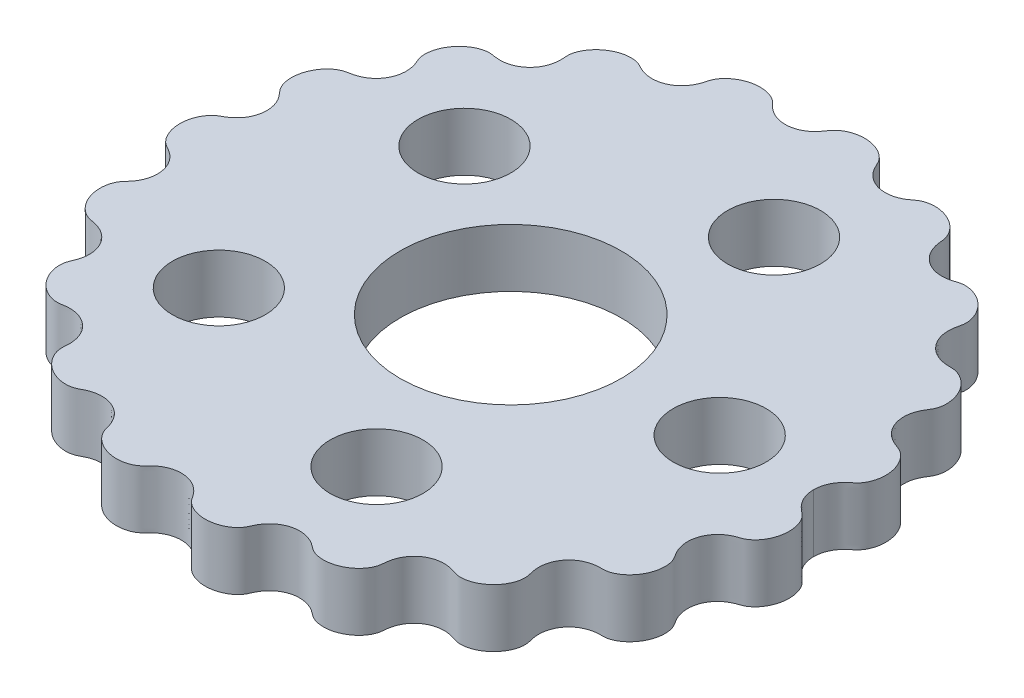
from build123d import *

# Parameters (mm, degrees)
BOSS_EXTRUDE1_START = 0.5
SKETCH1_R           = 9.525
SKETCH1_R_2         = 4
BOSS_EXTRUDE1_DEPTH = 5


with BuildPart() as part:
    # Sketch1 → Boss-Extrude1 (new body)
    with BuildSketch(Plane(origin=(0, 0, 0), x_dir=(1, 0, 0), z_dir=(0, 1, 0)).offset(BOSS_EXTRUDE1_START)):
        with BuildLine():
            add(Edge.make_bspline(
                [(26.1, 0), (26.1, -0.037654823), (26.101959838, -0.112657778), (26.110778913, -0.269126865), (26.134236473, -0.431457933), (26.169271902, -0.604227737), (26.215706934, -0.771665888), (26.273295099, -0.936077152), (26.341753554, -1.096140667), (26.427915849, -1.265624131), (26.534785054, -1.441856171), (26.699683698, -1.67031679), (26.901439536, -1.88987584), (27.124804261, -2.086960491), (27.362808407, -2.265185488), (27.541686595, -2.422902757), (27.696832366, -2.612532966), (27.831038283, -2.823925745), (27.942707414, -3.055157968), (28.032027129, -3.302051278), (28.11328707, -3.620150325), (28.164200716, -4.011385863), (28.158229712, -4.465911271), (28.068723695, -4.971978987), (27.922396839, -5.391891507), (27.752179238, -5.726439419), (27.579155333, -5.986088777), (27.422588116, -6.181127718), (27.208663224, -6.396612626), (26.970426874, -6.581500429), (26.704262293, -6.714420074), (26.426139511, -6.802056051), (26.208386955, -6.88526241), (25.996005013, -6.981754411), (25.792352168, -7.095680473), (25.506454673, -7.288419365), (25.166810015, -7.595932092), (24.823327666, -8.065640834), (24.573113299, -8.722842261), (24.513192386, -9.374110704), (24.595878356, -9.908866565), (24.732910005, -10.306165942), (24.863450157, -10.578322253), (24.983619743, -10.787813544), (25.118076955, -10.987994036), (25.243899654, -11.194436481), (25.335973848, -11.425133948), (25.399465388, -11.670686177), (25.434320142, -11.928228009), (25.441972482, -12.193681648), (25.418791023, -12.524941115), (25.342360012, -12.916594688), (25.19123207, -13.347764304), (24.944934541, -13.798710217), (24.636097611, -14.197365909), (24.319379046, -14.492995791), (24.014552178, -14.704170688), (23.744181637, -14.84409763), (23.521984723, -14.930759504), (23.295178333, -14.99089675), (23.066212192, -15.018050457), (22.836177533, -15.015427607), (22.606453619, -15.01876633), (22.377139997, -15.037432831), (22.149964765, -15.073477643), (21.901722715, -15.134262004), (21.636405279, -15.227464361), (21.285248204, -15.397408544), (20.867012031, -15.696199645), (20.457707613, -16.15442787), (20.167634198, -16.744097483), (20.040652676, -17.344074218), (20.044251146, -17.837567352), (20.101291606, -18.208300972), (20.178290252, -18.510160997), (20.237387065, -18.752911084), (20.25416585, -19.007094176), (20.236737196, -19.264546648), (20.175345508, -19.587685891), (20.045401481, -19.966212229), (19.825733648, -20.379092954), (19.503349147, -20.792215121), (19.125691797, -21.140607349), (18.706122195, -21.419205006), (18.312603134, -21.597813456), (17.957291469, -21.7007495), (17.659059082, -21.747208145), (17.425046357, -21.759337106), (17.196962801, -21.74598206), (16.978070968, -21.704489959), (16.76754266, -21.633081261), (16.557577444, -21.561231407), (16.343192491, -21.502693833), (16.125264662, -21.459296016), (15.796467784, -21.420434357), (15.354937395, -21.427964236), (14.788969175, -21.550301969), (14.154555419, -21.88057341), (13.666183716, -22.345893253), (13.336362648, -22.88226304), (13.173492135, -23.353715628), (13.104616127, -23.716957195), (13.076673275, -24.02279806), (13.057814188, -24.268242303), (12.998712205, -24.514111874), (12.903235055, -24.754151925), (12.744151813, -25.045309117), (12.499019901, -25.369043134), (12.15565715, -25.696338346), (11.704870212, -25.994619846), (11.211604107, -26.212225806), (10.689976759, -26.343697667), (10.221282681, -26.37756552), (9.820613034, -26.342575187), (9.498973157, -26.26665957), (9.255580912, -26.177092448), (9.029799658, -26.056558541), (8.831572761, -25.902571784), (8.58391576, -25.71111477), (8.26446612, -25.51104552), (7.810081455, -25.312340621), (7.205513818, -25.192791232), (6.550224923, -25.228730886), (5.971337017, -25.424349477), (5.536862388, -25.687803773), (5.245653306, -25.938729612), (5.05538626, -26.143844122), (4.899938261, -26.348212338), (4.774598737, -26.545523005), (4.66455004, -26.751857795), (4.569043475, -26.964881996), (4.476314366, -27.179586841), (4.35349979, -27.379281189), (4.203299855, -27.561863118), (4.032131291, -27.727950003), (3.795258989, -27.914521158), (3.482483913, -28.102825699), (3.089596664, -28.268830385), (2.604961188, -28.388334129), (2.095437225, -28.431200093), (1.573536082, -28.390048007), (1.119470452, -28.272805038), (0.751616161, -28.112409401), (0.472786699, -27.939857046), (0.273494126, -27.780889901), (0.100220003, -27.601224467), (-0.036900458, -27.400701128), (-0.167623209, -27.196704665), (-0.313051845, -27.002366981), (-0.512485216, -26.773835259), (-0.825221581, -26.489940267), (-1.286824514, -26.202366803), (-1.906524561, -26.003420899), (-2.599411553, -25.975353149), (-3.156761697, -26.100953574), (-3.565273796, -26.283242121), (-3.85343043, -26.463789354), (-4.040862241, -26.604608953), (-4.216144571, -26.760241463), (-4.380398315, -26.92724911), (-4.535647832, -27.102695562), (-4.708038901, -27.262129389), (-4.906562373, -27.395532872), (-5.122340192, -27.506639083), (-5.353111082, -27.594765527), (-5.595122062, -27.660809079), (-5.904112165, -27.714960076), (-6.280362612, -27.736643211), (-6.724192808, -27.701413516), (-7.222479814, -27.579956195), (-7.639241179, -27.403463388), (-7.974539319, -27.20159547), (-8.231562236, -27.001455404), (-8.420763279, -26.822438839), (-8.588375147, -26.628010193), (-8.729951421, -26.419225268), (-8.843841456, -26.197883212), (-8.918149442, -25.965106023), (-8.973095058, -25.727696563), (-9.043925473, -25.494305037), (-9.153099618, -25.209622768), (-9.306801806, -24.915867583), (-9.513499076, -24.623747572), (-9.839816185, -24.284860522), (-10.264400599, -23.977825959), (-10.829665695, -23.73805203), (-11.410498796, -23.660908882), (-11.876291721, -23.69638221), (-12.218754959, -23.773476834), (-12.444677349, -23.845131331), (-12.663781479, -23.935334112), (-12.876076729, -24.040286172), (-13.082031425, -24.157155246), (-13.298581127, -24.254322867), (-13.533913594, -24.317810826), (-13.780466915, -24.35378875), (-14.035834908, -24.361637388), (-14.29640587, -24.343065665), (-14.618522573, -24.288656576), (-14.994949776, -24.177456101), (-15.40857897, -23.98833338), (-15.837205258, -23.700628449), (-16.164907311, -23.393911293), (-16.404344734, -23.097848292), (-16.573318676, -22.829755719), (-16.687662049, -22.603571121), (-16.776686853, -22.372337621), (-16.837746076, -22.138542446), (-16.870186159, -21.9045043), (-16.866368416, -21.674536104), (-16.843233106, -21.446228653), (-16.832615307, -21.216921003), (-16.837266827, -20.987328792), (-16.860312683, -20.758768834), (-16.923293404, -20.419212422), (-17.071833991, -19.980587652), (-17.369040524, -19.477210915), (-17.874882375, -18.988476541), (-18.447970133, -18.67719025), (-19.027548134, -18.525710765), (-19.510111737, -18.503831617), (-19.87664814, -18.538267665), (-20.177623885, -18.593432706), (-20.421371941, -18.622411671), (-20.671244853, -18.609095567), (-20.920859775, -18.564988583), (-21.167935078, -18.490627654), (-21.4095885, -18.389962143), (-21.698210119, -18.235368531), (-22.02014446, -18.009296139), (-22.350982927, -17.698329853), (-22.663749807, -17.29065213), (-22.904833826, -16.843369276), (-23.047778377, -16.427343965), (-23.116267899, -16.057121475), (-23.13204139, -15.75076918), (-23.118687314, -15.513701439), (-23.079662446, -15.285779121), (-23.010740762, -15.071995011), (-22.917965639, -14.867945737), (-22.831783511, -14.661241535), (-22.759010838, -14.449176582), (-22.702274861, -14.232285466), (-22.657962992, -13.982307736), (-22.635886805, -13.699380389), (-22.650675118, -13.300053937), (-22.761871082, -12.783822482), (-23.029318637, -12.21492364), (-23.467562019, -11.712001704), (-23.923403018, -11.398122255), (-24.315464064, -11.222988994), (-24.609412242, -11.131419108), (-24.849484665, -11.076013531), (-25.092573069, -11.038656205), (-25.334505588, -10.990769991), (-25.569274269, -10.900544213), (-25.793687584, -10.779741828), (-26.005954771, -10.630692764), (-26.204437626, -10.457777096), (-26.43033221, -10.218351564), (-26.664824109, -9.899800806), (-26.878975385, -9.499593675), (-27.044436206, -9.01574461), (-27.129961924, -8.520121003), (-27.134474175, -8.0871314), (-27.084857153, -7.719810764), (-27.006013082, -7.425910719), (-26.920443462, -7.203342298), (-26.812236107, -6.99521479), (-26.678616217, -6.807274427), (-26.521312285, -6.639361313), (-26.367637466, -6.468593342), (-26.225484226, -6.287683037), (-26.097389187, -6.096643611), (-25.974680445, -5.876177314), (-25.864713463, -5.624531597), (-25.752433682, -5.264729725), (-25.681810262, -4.762581394), (-25.73099742, -4.146949182), (-25.961949286, -3.524047609), (-26.321265325, -3.010597952), (-26.690239718, -2.672986455), (-27.000992368, -2.462677557), (-27.274877294, -2.314024503), (-27.49416336, -2.194208061), (-27.693761753, -2.035785351), (-27.872384261, -1.849426066), (-28.029881682, -1.639477669), (-28.165833209, -1.41056993), (-28.278417606, -1.169112764), (-28.356850629, -0.949924532), (-28.40992651, -0.757383066), (-28.444786226, -0.594531067), (-28.467072671, -0.464613598), (-28.483773852, -0.334062838), (-28.494901549, -0.194206271), (-28.499073008, -0.086237954), (-28.5, -0.028769446), (-28.5, 0)],
                knots=[0.065357727, 0.065357727, 0.065357727, 0.065357727, 0.065357727, 0.066838802, 0.068319877, 0.069800952, 0.071282027, 0.072763102, 0.074244177, 0.075725252, 0.077206327, 0.079230954, 0.081255581, 0.085304836, 0.087329463, 0.08935409, 0.091378717, 0.093403344, 0.095635344, 0.097867345, 0.100099346, 0.102331347, 0.106795348, 0.11125935, 0.115505731, 0.119752112, 0.121875303, 0.123998494, 0.126121685, 0.128244875, 0.132212277, 0.134195978, 0.136179679, 0.13816338, 0.140147081, 0.142130782, 0.144114483, 0.149889299, 0.155664115, 0.161716618, 0.167769121, 0.171875721, 0.17392902, 0.17598232, 0.17803562, 0.18008892, 0.182142219, 0.184195519, 0.186452911, 0.188710303, 0.190967695, 0.193225087, 0.197739871, 0.202254655, 0.206449673, 0.210644692, 0.21483971, 0.216937219, 0.219034728, 0.220990732, 0.222946736, 0.22490274, 0.226858744, 0.228814748, 0.230770752, 0.232726756, 0.23468276, 0.237505487, 0.240328214, 0.245973668, 0.25207373, 0.258173791, 0.262418319, 0.266662848, 0.268785112, 0.270907376, 0.27302964, 0.275151904, 0.277414155, 0.279676405, 0.284200907, 0.288725408, 0.29324991, 0.297434601, 0.301619291, 0.305803982, 0.307896327, 0.309988673, 0.311878349, 0.313768025, 0.315657701, 0.317547377, 0.319437053, 0.32132673, 0.323216406, 0.325106082, 0.330697764, 0.336289446, 0.3427217, 0.349153953, 0.353337838, 0.357521724, 0.359613666, 0.361705609, 0.363797552, 0.365889495, 0.368183967, 0.37047844, 0.375067386, 0.379656332, 0.384245278, 0.388791482, 0.393337686, 0.39788389, 0.400156991, 0.402430093, 0.404562559, 0.406695025, 0.408827491, 0.410959957, 0.415224889, 0.419489821, 0.425619329, 0.431748836, 0.43728204, 0.440048642, 0.442815244, 0.444803142, 0.446791041, 0.44877894, 0.450766838, 0.452754737, 0.454742636, 0.456730534, 0.458718433, 0.460783687, 0.462848941, 0.466979449, 0.471109956, 0.475240464, 0.479777245, 0.484314026, 0.488850807, 0.491119197, 0.493387587, 0.495450918, 0.497514249, 0.499577579, 0.50164091, 0.503704241, 0.505767572, 0.509894233, 0.515977148, 0.522060063, 0.527644163, 0.533228263, 0.535221378, 0.537214493, 0.539207608, 0.541200724, 0.543193839, 0.545186954, 0.54718007, 0.549173185, 0.551305995, 0.553438805, 0.555571614, 0.557704424, 0.561970044, 0.566235664, 0.570664673, 0.575093682, 0.577308187, 0.579522691, 0.581737196, 0.583951701, 0.586025843, 0.588099985, 0.590174127, 0.592248269, 0.594322411, 0.596396553, 0.600544837, 0.603500405, 0.606455973, 0.612367108, 0.61826056, 0.624154012, 0.626168793, 0.628183573, 0.630198354, 0.632213134, 0.634227915, 0.636242695, 0.638257476, 0.640272256, 0.642493095, 0.644713933, 0.646934771, 0.64915561, 0.653597287, 0.658038963, 0.662348161, 0.666657359, 0.668811958, 0.670966557, 0.673121156, 0.675275756, 0.677228627, 0.679181499, 0.681134371, 0.683087243, 0.685040114, 0.686992986, 0.688945858, 0.69089873, 0.696785964, 0.702673198, 0.708614477, 0.714555757, 0.718723943, 0.722892129, 0.724976222, 0.727060315, 0.729144408, 0.7312285, 0.733454223, 0.735679945, 0.737905667, 0.740131389, 0.744582833, 0.749034278, 0.753292913, 0.757551548, 0.761810184, 0.763939501, 0.766068819, 0.767975191, 0.769881564, 0.771787936, 0.773694308, 0.77560068, 0.777507052, 0.779413425, 0.781319797, 0.784235185, 0.787150573, 0.792981348, 0.799176944, 0.80537254, 0.809561259, 0.811655619, 0.813749979, 0.815844338, 0.817938698, 0.820033058, 0.822127418, 0.82436519, 0.826602962, 0.828840734, 0.831078507, 0.835554051, 0.840029596, 0.844222519, 0.848415442, 0.852608365, 0.854704826, 0.856801288, 0.858757317, 0.860713346, 0.862669375, 0.864625404, 0.866581433, 0.868537462, 0.870493491, 0.872449521, 0.875160805, 0.87787209, 0.883294658, 0.889615361, 0.895936064, 0.900181909, 0.904427753, 0.906550675, 0.908673598, 0.91079652, 0.912919442, 0.915182616, 0.91744579, 0.919708964, 0.921972138, 0.924235312, 0.925366899, 0.926498486, 0.927630073, 0.92876166, 0.929893247, 0.931024834, 0.931024834, 0.931024834, 0.931024834, 0.931024834], degree=4))
            add(Edge.make_bspline(
                [(26.1, 0), (26.1, 0.037557605), (26.101960171, 0.11236891), (26.11078076, 0.268515148), (26.134241319, 0.430312774), (26.169279566, 0.602699324), (26.215712535, 0.769655848), (26.273296837, 0.933610032), (26.341723749, 1.093214642), (26.427887255, 1.262171064), (26.534631094, 1.437956629), (26.664721279, 1.617457311), (26.820221457, 1.797178197), (26.990110154, 1.963295025), (27.170908294, 2.117246114), (27.359583137, 2.261393394), (27.534725755, 2.422495239), (27.68734562, 2.613319468), (27.819402465, 2.825437942), (27.929409737, 3.056775069), (28.017350198, 3.303529964), (28.097313972, 3.621173349), (28.14718039, 4.011594981), (28.140708419, 4.466301535), (28.050717291, 4.97349364), (27.882896183, 5.454979192), (27.671504474, 5.843043809), (27.44357466, 6.14485749), (27.22674656, 6.364817608), (27.040892977, 6.516562131), (26.843642223, 6.643249286), (26.635913668, 6.738215402), (26.419935905, 6.811078153), (26.206939902, 6.891943154), (25.999467088, 6.986584145), (25.799911288, 7.096971584), (25.514583784, 7.286926668), (25.171992168, 7.593045832), (24.825107804, 8.063163705), (24.5729884, 8.722990296), (24.513513946, 9.375105338), (24.596667177, 9.908457378), (24.733854448, 10.304635683), (24.864153794, 10.576176989), (24.983841337, 10.785268449), (25.116626146, 10.985976921), (25.23781854, 11.19454866), (25.326672131, 11.425792091), (25.387836906, 11.671325815), (25.420923382, 11.928463132), (25.427271397, 12.193315351), (25.402925967, 12.523691904), (25.325735565, 12.914209417), (25.174039331, 13.345327688), (24.926907331, 13.797258339), (24.616364755, 14.197845718), (24.29698117, 14.495520078), (23.989587623, 14.708050701), (23.718534775, 14.847912779), (23.49790773, 14.934027895), (23.274665325, 14.993741496), (23.051299597, 15.022739648), (22.826527034, 15.023767999), (22.602061074, 15.027768326), (22.378022274, 15.045955422), (22.15589886, 15.080417823), (21.828556405, 15.158511555), (21.409282012, 15.322259794), (20.924725716, 15.635210395), (20.456823885, 16.15782959), (20.166872697, 16.748469446), (20.041025764, 17.347126751), (20.045267093, 17.839438353), (20.102257891, 18.209228311), (20.177807446, 18.510727553), (20.231772918, 18.754068221), (20.244874723, 19.007789076), (20.225231154, 19.26440437), (20.174580683, 19.52116384), (20.09617018, 19.774796717), (19.967529458, 20.080829599), (19.769244222, 20.426950741), (19.48836858, 20.785956984), (19.112265891, 21.132969663), (18.695113942, 21.411025316), (18.304377275, 21.589914677), (17.951596369, 21.694385137), (17.597097582, 21.752232251), (17.302747889, 21.761285903), (17.01353957, 21.72416988), (16.741890871, 21.635235734), (16.525460697, 21.563366751), (16.30449365, 21.505143995), (16.079996624, 21.463086124), (15.830837481, 21.437177305), (15.558265867, 21.434810852), (15.186128323, 21.472203392), (14.696111953, 21.603682941), (14.145806732, 21.892344423), (13.663352315, 22.352831799), (13.335089923, 22.888301692), (13.173326778, 23.358816985), (13.10466991, 23.721205101), (13.075926055, 24.02625008), (13.052488399, 24.270732841), (12.989529913, 24.51498191), (12.892121578, 24.75348234), (12.73129963, 25.042745905), (12.48537644, 25.364486059), (12.14194144, 25.689934199), (11.690895191, 25.987555412), (11.196405878, 26.205372018), (10.672319964, 26.337289188), (10.200295403, 26.371119582), (9.79682711, 26.335572462), (9.474750205, 26.259329406), (9.232977676, 26.17056519), (9.009974637, 26.052913705), (8.813709595, 25.905471503), (8.570429252, 25.719531022), (8.258164128, 25.523707411), (7.809364316, 25.324975745), (7.207254198, 25.202018597), (6.546067121, 25.235297975), (5.877241902, 25.46217649), (5.398588959, 25.786008977), (5.084963573, 26.105496235), (4.885275351, 26.374184303), (4.766566725, 26.56369587), (4.661655149, 26.761176326), (4.569316509, 26.964531297), (4.477345935, 27.168404949), (4.359380537, 27.358962352), (4.214368301, 27.53730225), (4.04657292, 27.702735184), (3.809779019, 27.892470211), (3.492450279, 28.086181237), (3.093047806, 28.256870656), (2.602432058, 28.378851651), (2.089146834, 28.422578188), (1.565967934, 28.381961626), (1.112700174, 28.266239984), (0.745063975, 28.107841233), (0.465765003, 27.937570102), (0.265546245, 27.780769343), (0.090316159, 27.603947454), (-0.050614273, 27.406772328), (-0.182236215, 27.203960446), (-0.32748241, 27.01023592), (-0.526391485, 26.782147944), (-0.838010778, 26.498557331), (-1.298111394, 26.211094086), (-1.918402994, 26.011412018), (-2.614461149, 25.984022917), (-3.173523862, 26.112524982), (-3.581992111, 26.29793532), (-3.867307934, 26.479069847), (-4.049922769, 26.617384469), (-4.221152863, 26.769533189), (-4.381916757, 26.932432712), (-4.535916963, 27.101844858), (-4.706349347, 27.255419887), (-4.902143243, 27.386349656), (-5.116496624, 27.496610446), (-5.347239404, 27.585081759), (-5.591110656, 27.651879702), (-5.902424379, 27.706740788), (-6.281662868, 27.728850923), (-6.729961118, 27.693395981), (-7.234342379, 27.57024369), (-7.65633568, 27.390482111), (-7.996662398, 27.184271517), (-8.256329457, 26.979520574), (-8.448308601, 26.796657484), (-8.651059963, 26.555390104), (-8.81700112, 26.293818775), (-8.913447768, 26.039171491), (-8.970105978, 25.812426923), (-9.032713325, 25.58729032), (-9.125707716, 25.309967392), (-9.315929764, 24.909990901), (-9.674728567, 24.436130369), (-10.183459835, 24.025846062), (-10.836211591, 23.747068892), (-11.420435291, 23.669904101), (-11.88504253, 23.705810937), (-12.226667293, 23.783060411), (-12.452036547, 23.854757814), (-12.670772627, 23.944623883), (-12.882685423, 24.04910601), (-13.089636758, 24.163269032), (-13.307649025, 24.25586997), (-13.543038731, 24.316628716), (-13.789378657, 24.350416644), (-14.044170323, 24.356729239), (-14.304069866, 24.336979732), (-14.625232978, 24.28158743), (-15.000545755, 24.169770966), (-15.412965418, 23.980630522), (-15.840661536, 23.693607689), (-16.214284288, 23.344751587), (-16.484954149, 22.992579821), (-16.66924689, 22.660103051), (-16.782520625, 22.371064468), (-16.845505846, 22.138296706), (-16.880496111, 21.905251417), (-16.881316199, 21.675736003), (-16.860821292, 21.447623517), (-16.850555776, 21.218839449), (-16.855364031, 20.989715925), (-16.878196474, 20.761647471), (-16.940732923, 20.422799562), (-17.08843954, 19.985128723), (-17.385800937, 19.480651112), (-17.894498222, 18.99046133), (-18.469877881, 18.681086595), (-18.990372753, 18.548665966), (-19.406487185, 18.518804425), (-19.705993797, 18.531117789), (-19.944219194, 18.557992617), (-20.18020116, 18.599236489), (-20.419074353, 18.623629916), (-20.665189551, 18.609868388), (-20.913081212, 18.565696025), (-21.160188551, 18.491600021), (-21.403579002, 18.390348128), (-21.694263355, 18.234921696), (-22.018523547, 18.007449916), (-22.351791039, 17.694414257), (-22.666813538, 17.283805034), (-22.909544257, 16.833152952), (-23.05328345, 16.413896067), (-23.121977202, 16.040814849), (-23.137486808, 15.73333485), (-23.124191467, 15.496830586), (-23.085834476, 15.27070552), (-23.019759809, 15.059270031), (-22.930938394, 14.856805801), (-22.846986577, 14.652472592), (-22.775838439, 14.443088067), (-22.720106096, 14.229079512), (-22.661167611, 13.897241052), (-22.644448196, 13.442707496), (-22.741948127, 12.865327357), (-23.045635909, 12.219196868), (-23.44242448, 11.764680971), (-23.836324638, 11.475330273), (-24.161017984, 11.306249651), (-24.388411485, 11.212728737), (-24.623075892, 11.13984931), (-24.862494236, 11.084293926), (-25.104833104, 11.045464819), (-25.345143534, 10.992581071), (-25.578096716, 10.899626693), (-25.800907749, 10.777130543), (-26.011679105, 10.6270765), (-26.208845565, 10.453618678), (-26.433311015, 10.213944036), (-26.666458308, 9.895605218), (-26.879612895, 9.496087063), (-27.044681042, 9.013360245), (-27.130595174, 8.518940819), (-27.1361498, 8.086925062), (-27.088099036, 7.720199825), (-27.011063532, 7.426513435), (-26.927412143, 7.203721198), (-26.82146914, 6.995052926), (-26.691353099, 6.805240005), (-26.537235644, 6.635002809), (-26.384390326, 6.464109969), (-26.24276044, 6.28338013), (-26.114855809, 6.092759785), (-25.992262139, 5.872830792), (-25.882318572, 5.621822442), (-25.770018774, 5.262920475), (-25.698994496, 4.759665907), (-25.749262159, 4.140759285), (-25.983377251, 3.517989478), (-26.34496785, 3.008162522), (-26.711826659, 2.675630856), (-27.015956615, 2.470138444), (-27.283130805, 2.323166563), (-27.495697151, 2.202427731), (-27.691533018, 2.045315012), (-27.868698672, 1.860041494), (-28.02624223, 1.650179776), (-28.163215016, 1.419802986), (-28.276658401, 1.176817039), (-28.355709734, 0.956173448), (-28.409204864, 0.762425721), (-28.444342965, 0.598457075), (-28.466807893, 0.467595466), (-28.483643201, 0.33633456), (-28.494860457, 0.195831201), (-28.499065537, 0.086806089), (-28.5, 0.028958743), (-28.5, 0)],
                knots=[0.065428509, 0.065428509, 0.065428509, 0.065428509, 0.065428509, 0.066909165, 0.06838982, 0.069870476, 0.071351132, 0.072831787, 0.074312443, 0.075793099, 0.077273754, 0.079298617, 0.08132348, 0.083348342, 0.085373205, 0.087398068, 0.089422931, 0.091447793, 0.093472656, 0.095704556, 0.097936456, 0.100168356, 0.102400256, 0.106864056, 0.111327856, 0.11561548, 0.119903104, 0.124190727, 0.126334539, 0.128478351, 0.130421745, 0.13236514, 0.134308534, 0.136251928, 0.138195322, 0.140138717, 0.142082111, 0.144025505, 0.149879071, 0.155732636, 0.161783086, 0.167833536, 0.171940286, 0.17399366, 0.176047035, 0.17810041, 0.180153784, 0.182207159, 0.184260534, 0.186517645, 0.188774756, 0.191031868, 0.193288979, 0.197803202, 0.202317424, 0.206554339, 0.210791254, 0.215028169, 0.217146627, 0.219265085, 0.22118072, 0.223096355, 0.22501199, 0.226927625, 0.22884326, 0.230758895, 0.23267453, 0.234590165, 0.240315033, 0.246039902, 0.252137777, 0.258235653, 0.262479911, 0.266724169, 0.268846298, 0.270968427, 0.273090556, 0.275212686, 0.277474466, 0.279736246, 0.281998027, 0.284259807, 0.288783368, 0.293306929, 0.297478465, 0.30165, 0.305821535, 0.307907303, 0.309993071, 0.313886946, 0.315833883, 0.31778082, 0.319727758, 0.321674695, 0.323621633, 0.32556857, 0.328264738, 0.330960906, 0.336353242, 0.34278217, 0.349211099, 0.353394823, 0.357578547, 0.359670409, 0.361762271, 0.363854133, 0.365945995, 0.3682398, 0.370533604, 0.375121214, 0.379708823, 0.384296433, 0.388884931, 0.393473428, 0.398061926, 0.400356175, 0.402650424, 0.404740985, 0.406831546, 0.408922108, 0.411012669, 0.415193791, 0.419374914, 0.425582296, 0.431789679, 0.437483986, 0.443178293, 0.445084123, 0.446989952, 0.448895782, 0.450801611, 0.452707441, 0.45461327, 0.4565191, 0.458424929, 0.460532562, 0.462640195, 0.46685546, 0.471070725, 0.47528599, 0.479822206, 0.484358421, 0.488894637, 0.491162745, 0.493430852, 0.495494138, 0.497557424, 0.49962071, 0.501683995, 0.503747281, 0.505810567, 0.509937139, 0.516017911, 0.522098683, 0.52776142, 0.533424156, 0.535376276, 0.537328396, 0.539280516, 0.541232636, 0.543184755, 0.545136875, 0.547088995, 0.549041115, 0.551195406, 0.553349697, 0.555503988, 0.557658279, 0.561966861, 0.566275442, 0.57078566, 0.575295877, 0.577550985, 0.579806094, 0.582061202, 0.584316311, 0.588303705, 0.590297402, 0.591294251, 0.592291099, 0.596278494, 0.600265888, 0.606334723, 0.612403558, 0.6182954, 0.624187243, 0.626202375, 0.628217508, 0.63023264, 0.632247772, 0.634262905, 0.636278037, 0.638293169, 0.640308302, 0.642529051, 0.6447498, 0.64697055, 0.649191299, 0.653632797, 0.658074296, 0.66238357, 0.666692845, 0.67100212, 0.673156757, 0.675311394, 0.677264526, 0.679217658, 0.68117079, 0.683123922, 0.685077055, 0.687030187, 0.688983319, 0.690936451, 0.69682189, 0.702707329, 0.708727249, 0.714747169, 0.718834421, 0.720878047, 0.722921673, 0.724965299, 0.727008925, 0.729052551, 0.731096177, 0.733342138, 0.735588098, 0.737834058, 0.740080019, 0.744571939, 0.74906386, 0.753364202, 0.757664545, 0.761964887, 0.764115058, 0.766265229, 0.768149956, 0.770034683, 0.771919409, 0.773804136, 0.775688862, 0.777573589, 0.779458316, 0.781343042, 0.787178143, 0.793013244, 0.799206318, 0.805399393, 0.807493698, 0.809588002, 0.811682307, 0.813776612, 0.815870916, 0.817965221, 0.820059526, 0.82215383, 0.82439128, 0.826628731, 0.828866181, 0.831103631, 0.835578532, 0.840053432, 0.844246889, 0.848440346, 0.852633803, 0.854730531, 0.856827259, 0.858783839, 0.860740418, 0.862696998, 0.864653577, 0.866610157, 0.868566736, 0.870523316, 0.872479895, 0.875190971, 0.877902047, 0.883324198, 0.88972267, 0.896121142, 0.90028496, 0.904448778, 0.906530687, 0.908612596, 0.910694505, 0.912776414, 0.915059729, 0.917343045, 0.91962636, 0.921909675, 0.924192991, 0.925334648, 0.926476306, 0.927617964, 0.928759621, 0.929901279, 0.931042936, 0.931042936, 0.931042936, 0.931042936, 0.931042936], degree=4))
        make_face()
        Circle(SKETCH1_R, mode=Mode.SUBTRACT)
        with Locations((18, 0)):
            Circle(SKETCH1_R_2, mode=Mode.SUBTRACT)
        with Locations((5.562305899, -17.119017293)):
            Circle(SKETCH1_R_2, mode=Mode.SUBTRACT)
        with Locations((-14.562305899, -10.580134541)):
            Circle(SKETCH1_R_2, mode=Mode.SUBTRACT)
        with Locations((-14.562305899, 10.580134541)):
            Circle(SKETCH1_R_2, mode=Mode.SUBTRACT)
        with Locations((5.562305899, 17.119017293)):
            Circle(SKETCH1_R_2, mode=Mode.SUBTRACT)
    extrude(amount=BOSS_EXTRUDE1_DEPTH)


solid = part.part
